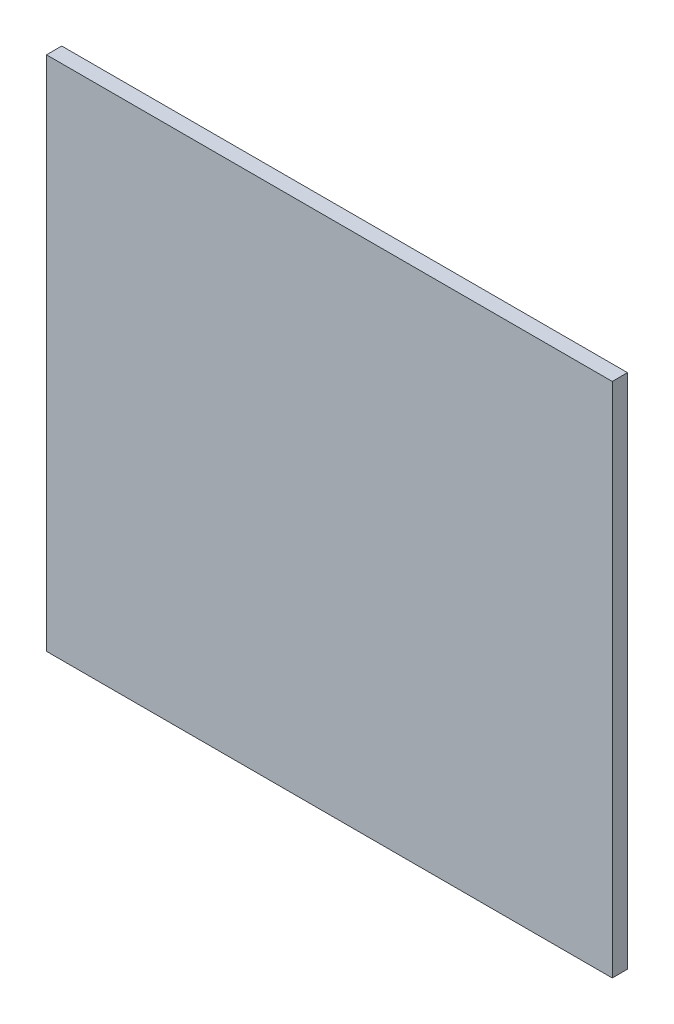
from build123d import *

# Parameters (mm, degrees)
SKETCH1_W           = 334
SKETCH1_H           = 305
BOSS_EXTRUDE1_DEPTH = 9


with BuildPart() as part:
    # Sketch1 → Boss-Extrude1 (new body)
    with BuildSketch(Plane.XY):
        Rectangle(SKETCH1_W, SKETCH1_H)
    extrude(amount=BOSS_EXTRUDE1_DEPTH)


solid = part.part
